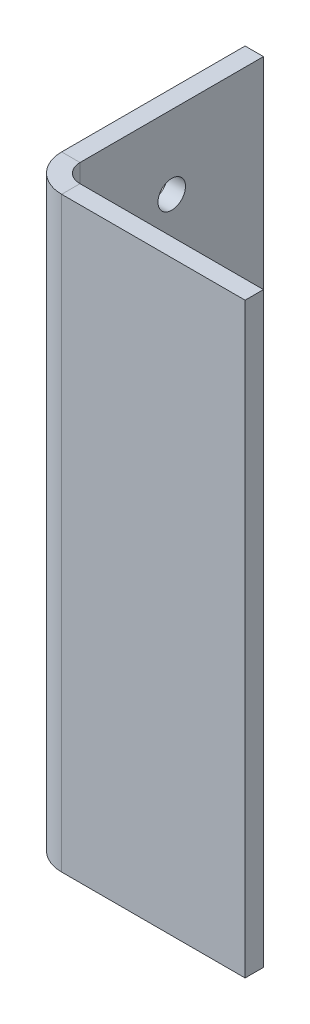
from build123d import *

# Parameters (mm, degrees)
BASE_FLANGE2_DEPTH = 101.6
SKETCH11_R         = 2.38125
CUT_EXTRUDE1_DEPTH = 114.990901501


# Sheet-metal steps are written as plain solids
with BuildPart() as part:
    # Sketch6 → Base-Flange2 (new body)
    with BuildSketch(Plane(origin=(0, 0, 0), x_dir=(1, 0, 0), z_dir=(0, 1, 0))):
        with BuildLine():
            Line((38.1, 0), (6.35, 0))
            ThreePointArc((6.35, 0), (1.859871939, 1.859871939), (0, 6.35))
            Line((0, 6.35), (0, 38.1))
            Line((0, 38.1), (3.175, 38.1))
            Line((3.175, 38.1), (3.175, 6.35))
            ThreePointArc((3.175, 6.35), (4.10493597, 4.10493597), (6.35, 3.175))
            Line((6.35, 3.175), (38.1, 3.175))
            Line((38.1, 3.175), (38.1, 0))
        make_face()
    extrude(amount=BASE_FLANGE2_DEPTH)

    # Sketch11 → Cut-Extrude1 (cut, through all)
    with BuildSketch(Plane(origin=(3.175, 0, 0), x_dir=(0, 0, -1), z_dir=(1, 0, 0))):
        with Locations((22.225, 88.9)):
            Circle(SKETCH11_R)
        with Locations((22.225, 12.7)):
            Circle(SKETCH11_R)
        with Locations((22.225, 50.8)):
            Circle(SKETCH11_R)
    extrude(amount=-CUT_EXTRUDE1_DEPTH, mode=Mode.SUBTRACT)


solid = part.part
